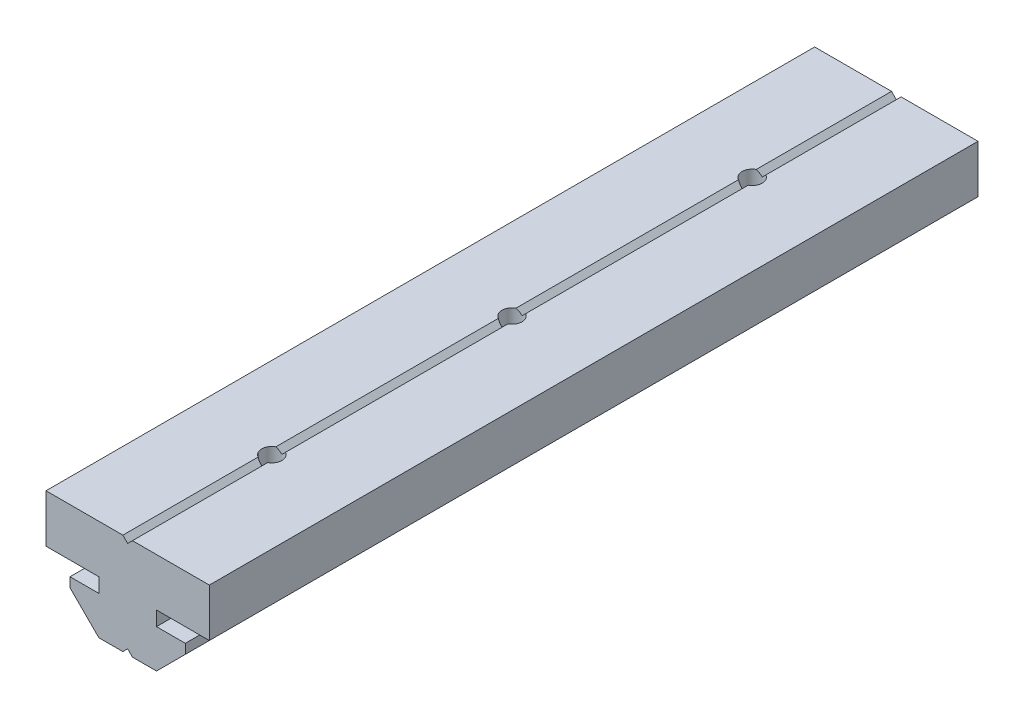
from build123d import *

# Parameters (mm, degrees)
BOSS_EXTRU_1_DEPTH      = 80
ESQUISSE2_R             = 1.05
ENL_V_MAT_EXTRU_1_DEPTH = 82.132607502


with BuildPart() as part:
    # Esquisse1 → Boss.-Extru.1 (new body)
    with BuildSketch(Plane.XY):
        Polygon((0, 10), (0.5, 10.5), (8.5, 10.5), (8.5, 5.5), (3, 5.5), (3, 4), (6, 4), (6, 3), (3, 0), (0.5, 0), (0, 0.5), (-0.5, 0), (-3, 0), (-6, 3), (-6, 4), (-3, 4), (-3, 5.5), (-8.5, 5.5), (-8.5, 10.5), (-0.5, 10.5), align=None)
    extrude(amount=BOSS_EXTRU_1_DEPTH)

    # Esquisse2 → Enlèv. mat.-Extru.1 (cut, through all)
    with BuildSketch(Plane(origin=(0, 10.5, 0), x_dir=(1, 0, 0), z_dir=(0, 1, 0))):
        with Locations((0, -65)):
            Circle(ESQUISSE2_R)
        with Locations((0, -40)):
            Circle(ESQUISSE2_R)
        with Locations((0, -15)):
            Circle(ESQUISSE2_R)
    extrude(amount=-ENL_V_MAT_EXTRU_1_DEPTH, mode=Mode.SUBTRACT)


solid = part.part
